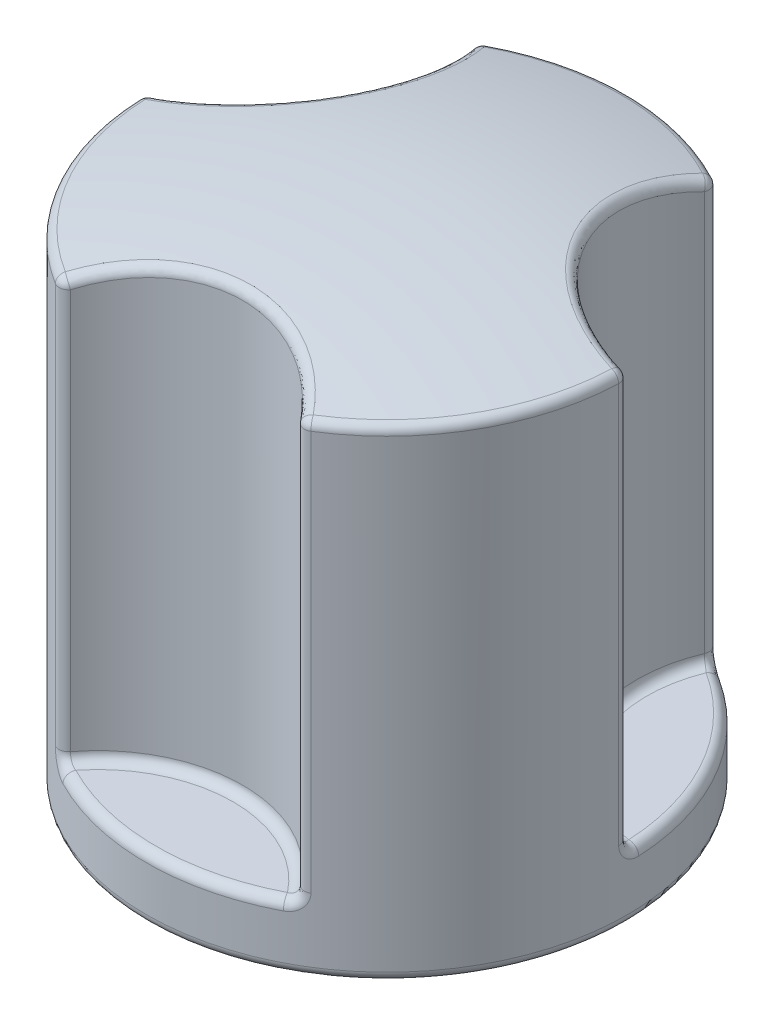
from build123d import *

# Parameters (mm, degrees)
SKETCH1_R           = 7.5
BOSS_EXTRUDE1_DEPTH = 15
DOME5_FACE_RADIUS   = 7.5
DOME5_HEIGHT        = 1
CUT_EXTRUDE4_START  = 2
CUT_EXTRUDE4_DEPTH  = 13.644075346
CIRPATTERN1_COUNT   = 3
FILLET6_R           = 0.3
SKETCH7_R           = 3.5
CUT_EXTRUDE5_DEPTH  = 3
SKETCH8_R           = 3.3
CUT_EXTRUDE6_DEPTH  = 10
SKETCH9_W           = 5.878775382
SKETCH9_H           = 1.8
BOSS_EXTRUDE3_DEPTH = 10


# Read off the part's stored shape, not the designer's step: Cut-Extrude4
with BuildPart() as part:
    # Sketch1 → Boss-Extrude1 (new body)
    with BuildSketch(Plane(origin=(0, 0, 0), x_dir=(1, 0, 0), z_dir=(0, 1, 0))):
        with Locations(Location((0, 0, 0), (0, 0, 270))):
            Circle(SKETCH1_R)
    extrude(amount=BOSS_EXTRUDE1_DEPTH)

    # Dome5: a dome of height H over a round flat face of radius A is a cap of a sphere of radius (A * A + H * H) / (2 * H)
    dome5_r = (DOME5_FACE_RADIUS * DOME5_FACE_RADIUS + DOME5_HEIGHT * DOME5_HEIGHT) / (2 * DOME5_HEIGHT)
    dome5_base = Plane((0, 15, 0), z_dir=(0, 1, 0))
    with Locations(dome5_base.offset(DOME5_HEIGHT - dome5_r)):
        dome5_ball = Sphere(dome5_r, mode=Mode.PRIVATE)
    add(split(dome5_ball, bisect_by=dome5_base, keep=Keep.TOP, mode=Mode.PRIVATE))

    # Cut-Extrude4 outline → Cut-Extrude4 (cut)
    with BuildSketch(Plane(origin=(0, 0, 0), x_dir=(1, 0, 0), z_dir=(0, 1, 0)).offset(CUT_EXTRUDE4_START)):
        with BuildLine():
            ThreePointArc((3.741657389, -6.500000003), (0, -4.5), (-3.741657389, -6.500000003))
            ThreePointArc((-3.741657389, -6.500000003), (0, -7.5), (3.741657389, -6.500000003))
        make_face()
    cut_extrude4 = extrude(amount=CUT_EXTRUDE4_DEPTH, mode=Mode.SUBTRACT)

    # CirPattern1: Cut-Extrude4 ×3 about axis
    cirpattern1_axis = Axis((0, 0, 0), (0, 1, 0))
    for i in range(1, CIRPATTERN1_COUNT):
        add(cut_extrude4.rotate(cirpattern1_axis, i * 360 / CIRPATTERN1_COUNT), mode=Mode.SUBTRACT)

    # Fillet6
    fillet6_edges = [part.edges().sort_by_distance(p)[0] for p in [
        (3.741657389, 8.5, 6.500000003),
        (0, 15, -7.5),
        (3.897114317, 15.644075418, -2.25),
        (6.495190528, 2, -3.75),
        (0, 0, -7.5),
        (3.897114317, 2, -2.25),
        (7.499993822, 8.5, -0.00962965),
        (3.758336433, 8.5, -6.490370353),
        (-6.495190528, 15, 3.75),
        (-3.897114317, 15.644075418, -2.25),
        (-6.495190528, 2, -3.75),
        (-3.897114317, 2, -2.25),
        (-3.758336433, 8.5, -6.490370353),
        (-7.499993822, 8.5, -0.00962965),
        (6.495190528, 15, 3.75),
        (-2.140049926, 15.471168424, 5.041441384),
        (1.936491674, 2, 7.245688374),
        (0, 2, 4.5),
        (-3.741657389, 8.5, 6.500000003),
    ]]
    fillet(fillet6_edges, radius=FILLET6_R)

    # Sketch7 → Cut-Extrude5 (cut)
    with BuildSketch(Plane.XZ):
        with Locations(Location((0, 0, 0), (0, 0, 270))):
            Circle(SKETCH7_R)
    extrude(amount=-CUT_EXTRUDE5_DEPTH, mode=Mode.SUBTRACT)

    # Sketch8 → Cut-Extrude6 (cut)
    with BuildSketch(Plane.XZ.offset(-3)):
        with Locations(Location((0, 0, 0), (0, 0, 270))):
            Circle(SKETCH8_R)
    extrude(amount=-CUT_EXTRUDE6_DEPTH, mode=Mode.SUBTRACT)

    # Sketch9 → Boss-Extrude3 (add)
    with BuildSketch(Plane.XZ.offset(-13)):
        with Locations((0, 2.4)):
            Rectangle(SKETCH9_W, SKETCH9_H)
    extrude(amount=BOSS_EXTRUDE3_DEPTH)


solid = part.part
